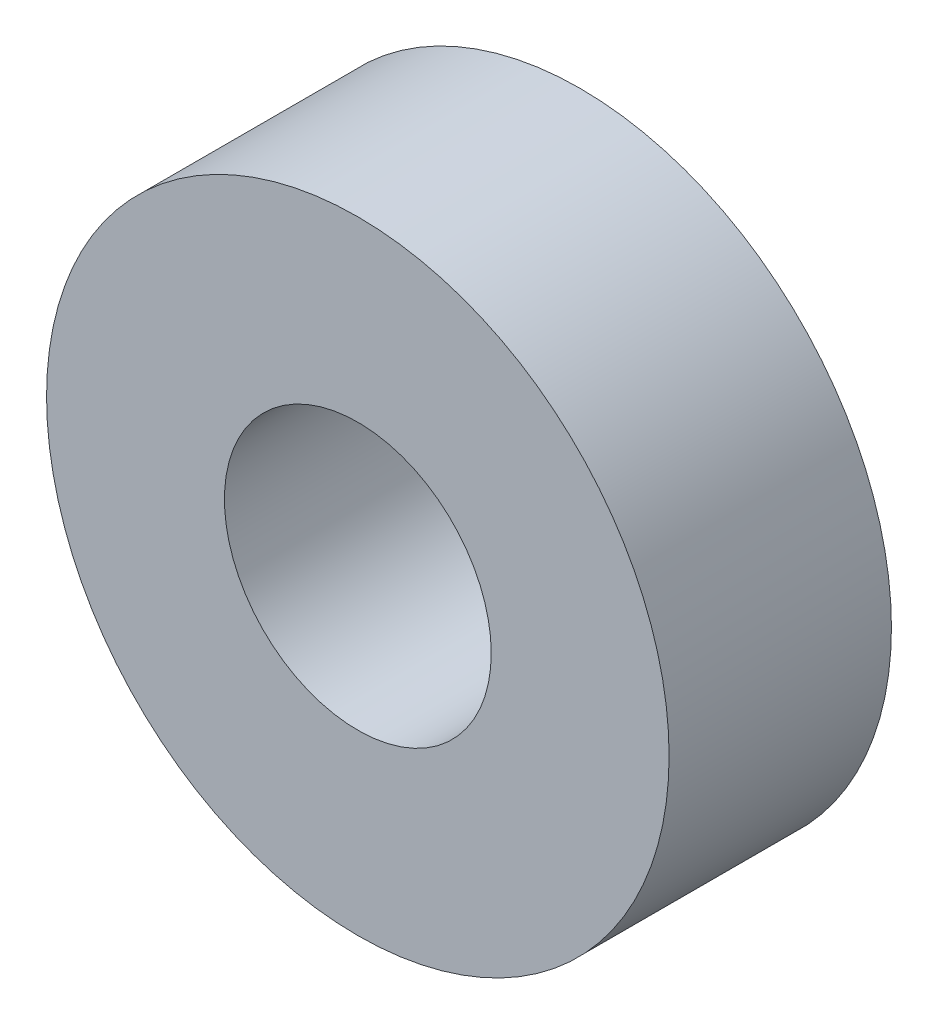
from build123d import *

# Parameters (mm, degrees)
SKETCH1_R           = 7
SKETCH1_R_2         = 3
BOSS_EXTRUDE1_DEPTH = 2.5


with BuildPart() as part:
    # Sketch1 → Boss-Extrude1 (new, symmetric)
    with BuildSketch(Plane.XY):
        Circle(SKETCH1_R)
        Circle(SKETCH1_R_2, mode=Mode.SUBTRACT)
    extrude(amount=BOSS_EXTRUDE1_DEPTH, both=True)


solid = part.part
